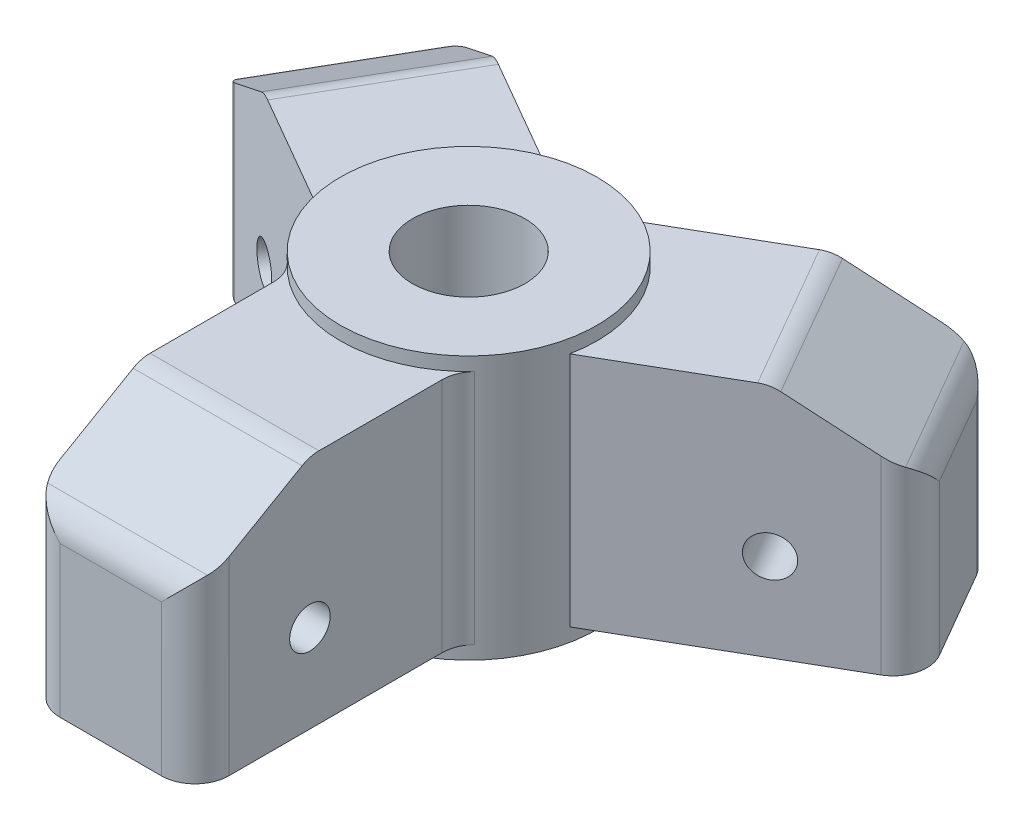
from build123d import *

# Parameters (mm, degrees)
CROQUIS2_R                = 19
SALIENTE_EXTRUIR1_DEPTH   = 39
CROQUIS3_W                = 25
CROQUIS3_H                = 35
SALIENTE_EXTRUIR2_DEPTH   = 53
CROQUIS4_R                = 3
CORTAR_EXTRUIR1_DEPTH     = 73.953752474
REDONDEO1_R               = 5
MATRIZC2_START            = 2
MATRIZC2_DEPTH            = 9.9999999
MATRIZC2_START_2          = 18.0000001
MATRIZC2_2_DEPTH          = 6.298293978
MATRIZC2_START_3          = 11.9999999
MATRIZC2_3_DEPTH          = 25.0000001
MATRIZC2_START_4          = -12.5
MATRIZC2_4_OUTLINE_R      = 3
MATRIZC2_4_DEPTH          = 25
MATRIZC2_5_OUTLINE_R      = 3
MATRIZC2_5_DEPTH          = 25
TALADRO_ROSCADO_3_4_102_D = 16.66748


with BuildPart() as part:
    # Croquis2 → Saliente-Extruir1 (new body)
    with BuildSketch(Plane(origin=(0, 0, 0), x_dir=(1, 0, 0), z_dir=(0, 1, 0))):
        with Locations(Location((0, 0, 0), (0, 0, 270))):
            Circle(CROQUIS2_R)
    extrude(amount=SALIENTE_EXTRUIR1_DEPTH)

    # Croquis3 → Saliente-Extruir2 (add)
    with BuildSketch(Plane.XY):
        with Locations((0, 19.5)):
            Rectangle(CROQUIS3_W, CROQUIS3_H)
    extrude(amount=SALIENTE_EXTRUIR2_DEPTH)

    # Croquis4 → Cortar-Extruir1 (cut, through all)
    with BuildSketch(Plane(origin=(12.5, 0, 0), x_dir=(0, 0, -1), z_dir=(1, 0, 0))):
        with Locations((-36, 15)):
            Circle(CROQUIS4_R)
        Polygon((-53, 27.185045424), (-53, 37), (-36, 37), align=None)
    extrude(amount=-CORTAR_EXTRUIR1_DEPTH, mode=Mode.SUBTRACT)

    # Redondeo1
    redondeo1_edges = [part.edges().sort_by_distance(p)[0] for p in [
        (12.5, 14.592522712, 53),
        (-12.5, 14.592522712, 53),
        (0, 27.185045424, 53),
        (0, 37, 36),
        (12.5, 19.5, 14.309088021),
        (-12.5, 19.5, 14.309088021),
    ]]
    fillet(redondeo1_edges, radius=REDONDEO1_R)

    # MatrizC2: read off the stored shape, not the designer's step
    # MatrizC2 outline → MatrizC2 (add)
    with BuildSketch(Plane(origin=(0, 0, 0), x_dir=(1, 0, 0), z_dir=(0, 1, 0)).offset(MATRIZC2_START)):
        with BuildLine():
            Line((-42.149346401, 32.995190528), (-49.649346401, 20.004809472))
            ThreePointArc((-49.649346401, 20.004809472), (-50.148848513, 16.210714247), (-47.819219382, 13.174682453))
            Line((-47.819219382, 13.174682453), (-18.642033731, -3.670773537))
            ThreePointArc((-18.642033731, -3.670773537), (-16.454482672, 9.5), (-6.142033731, 17.979861558))
            Line((-6.142033731, 17.979861558), (-35.319219382, 34.825317547))
            ThreePointArc((-35.319219382, 34.825317547), (-39.113314608, 35.32481966), (-42.149346401, 32.995190528))
        make_face()
        with BuildLine():
            ThreePointArc((6.142033731, 17.979861558), (16.454482672, 9.5), (18.642033731, -3.670773537))
            Line((18.642033731, -3.670773537), (47.819219382, 13.174682453))
            ThreePointArc((47.819219382, 13.174682453), (50.148848513, 16.210714247), (49.649346401, 20.004809472))
            Line((49.649346401, 20.004809472), (42.149346401, 32.995190528))
            ThreePointArc((42.149346401, 32.995190528), (39.113314608, 35.32481966), (35.319219382, 34.825317547))
            Line((35.319219382, 34.825317547), (6.142033731, 17.979861558))
        make_face()
    extrude(amount=MATRIZC2_DEPTH)

    # MatrizC2 2 outline → MatrizC2 2 (add)
    with BuildSketch(Plane(origin=(0, 0, 0), x_dir=(1, 0, 0), z_dir=(0, 1, 0)).offset(MATRIZC2_START_2)):
        with BuildLine():
            Line((-42.149346401, 32.995190528), (-49.649346401, 20.004809472))
            ThreePointArc((-49.649346401, 20.004809472), (-50.148848513, 16.210714247), (-47.819219382, 13.174682453))
            Line((-47.819219382, 13.174682453), (-18.642033731, -3.670773537))
            ThreePointArc((-18.642033731, -3.670773537), (-16.454482672, 9.5), (-6.142033731, 17.979861558))
            Line((-6.142033731, 17.979861558), (-35.319219382, 34.825317547))
            ThreePointArc((-35.319219382, 34.825317547), (-39.113314608, 35.32481966), (-42.149346401, 32.995190528))
        make_face()
        with BuildLine():
            ThreePointArc((6.142033731, 17.979861558), (16.454482672, 9.5), (18.642033731, -3.670773537))
            Line((18.642033731, -3.670773537), (47.819219382, 13.174682453))
            ThreePointArc((47.819219382, 13.174682453), (50.148848513, 16.210714247), (49.649346401, 20.004809472))
            Line((49.649346401, 20.004809472), (42.149346401, 32.995190528))
            ThreePointArc((42.149346401, 32.995190528), (39.113314608, 35.32481966), (35.319219382, 34.825317547))
            Line((35.319219382, 34.825317547), (6.142033731, 17.979861558))
        make_face()
    extrude(amount=MATRIZC2_2_DEPTH)

    # MatrizC2 3 outline → MatrizC2 3 (add)
    with BuildSketch(Plane(origin=(0, 0, 0), x_dir=(1, 0, 0), z_dir=(0, 1, 0)).offset(MATRIZC2_START_3)):
        with BuildLine():
            Line((-42.149346401, 32.995190528), (-49.649346401, 20.004809472))
            ThreePointArc((-49.649346401, 20.004809472), (-50.148848513, 16.210714247), (-47.819219382, 13.174682453))
            Line((-47.819219382, 13.174682453), (-18.642033731, -3.670773537))
            ThreePointArc((-18.642033731, -3.670773537), (-16.454482672, 9.5), (-6.142033731, 17.979861558))
            Line((-6.142033731, 17.979861558), (-35.319219382, 34.825317547))
            ThreePointArc((-35.319219382, 34.825317547), (-39.113314608, 35.32481966), (-42.149346401, 32.995190528))
        make_face()
        with BuildLine():
            ThreePointArc((6.142033731, 17.979861558), (16.454482672, 9.5), (18.642033731, -3.670773537))
            Line((18.642033731, -3.670773537), (47.819219382, 13.174682453))
            ThreePointArc((47.819219382, 13.174682453), (50.148848513, 16.210714247), (49.649346401, 20.004809472))
            Line((49.649346401, 20.004809472), (42.149346401, 32.995190528))
            ThreePointArc((42.149346401, 32.995190528), (39.113314608, 35.32481966), (35.319219382, 34.825317547))
            Line((35.319219382, 34.825317547), (6.142033731, 17.979861558))
        make_face()
    extrude(amount=MATRIZC2_3_DEPTH)

    # MatrizC2 4 outline → MatrizC2 4 (cut)
    with BuildSketch(Plane(origin=(0, 0, 0), x_dir=(0.8660254037844362, 0, -0.5000000000000042), z_dir=(0.5000000000000042, 0, 0.8660254037844363)).offset(MATRIZC2_START_4)):
        with BuildLine():
            ThreePointArc((34.660254038, 37), (35.954349263, 36.829629131), (37.160254038, 36.330127019))
            Line((37.160254038, 36.330127019), (50.5, 28.628421097))
            ThreePointArc((50.5, 28.628421097), (52.330127019, 26.798294078), (53, 24.298294078))
            Line((53, 24.298294078), (53.000000001, 37))
            Line((53.000000001, 37), (34.660254038, 37))
        make_face()
        with Locations((36, 15)):
            Circle(MATRIZC2_4_OUTLINE_R)
    extrude(amount=MATRIZC2_4_DEPTH, mode=Mode.SUBTRACT)

    # MatrizC2 5 outline → MatrizC2 5 (cut)
    with BuildSketch(Plane(origin=(0, 0, 0), x_dir=(0.8660254037844431, 0, 0.4999999999999921), z_dir=(0.4999999999999921, 0, -0.8660254037844433)).offset(MATRIZC2_START_4)):
        with BuildLine():
            ThreePointArc((-34.660254038, -37), (-35.954349263, -36.829629131), (-37.160254038, -36.330127019))
            Line((-37.160254038, -36.330127019), (-50.5, -28.628421097))
            ThreePointArc((-50.5, -28.628421097), (-52.330127019, -26.798294078), (-53, -24.298294078))
            Line((-53, -24.298294078), (-53, -37))
            Line((-53, -37), (-34.660254038, -37))
        make_face()
        with Locations((-36, -15)):
            Circle(MATRIZC2_5_OUTLINE_R)
    extrude(amount=MATRIZC2_5_DEPTH, mode=Mode.SUBTRACT)

    # Taladro roscado 3/4-102 (through all)
    with Locations(Plane.ZX.offset(39)):
        with Locations((0, 0)):
            Hole(TALADRO_ROSCADO_3_4_102_D / 2)


solid = part.part
